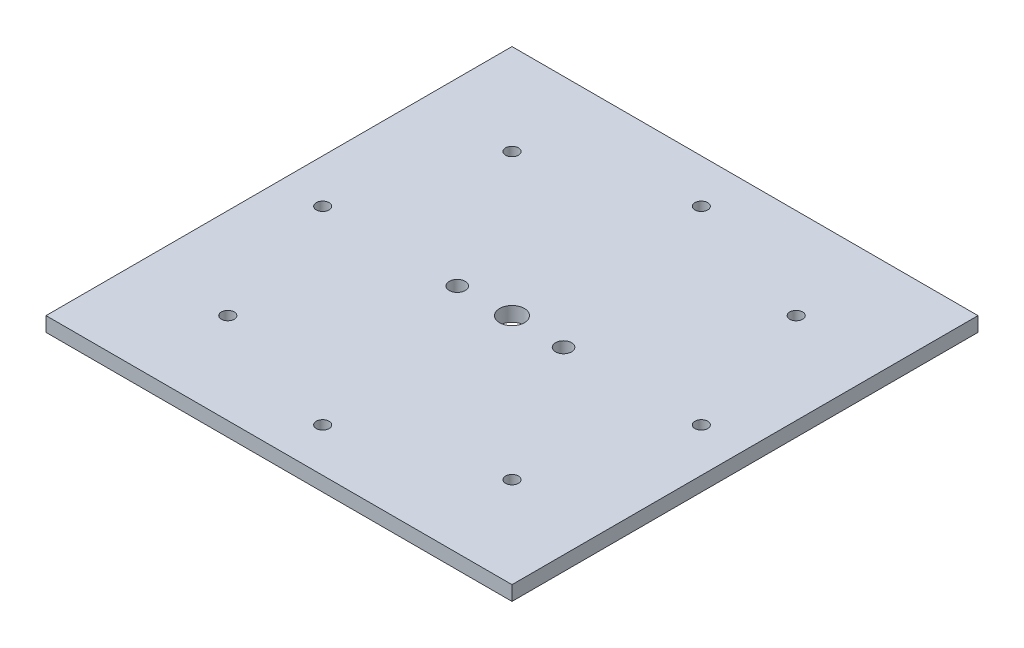
from build123d import *

# Parameters (mm, degrees)
SKETCH1_W           = 160
SKETCH1_H           = 160
SKETCH1_R           = 2.2
SKETCH1_R_2         = 4.25
SKETCH1_R_3         = 2.75
BOSS_EXTRUDE1_DEPTH = 5


with BuildPart() as part:
    # Sketch1 → Boss-Extrude1 (new body)
    with BuildSketch(Plane(origin=(0, 0, 0), x_dir=(1, 0, 0), z_dir=(0, 1, 0))):
        Rectangle(SKETCH1_W, SKETCH1_H)
        with Locations((48.790367902, 48.790367902)):
            Circle(SKETCH1_R, mode=Mode.SUBTRACT)
        with Locations((48.790367902, -48.790367902)):
            Circle(SKETCH1_R, mode=Mode.SUBTRACT)
        with Locations((-48.790367902, -48.790367902)):
            Circle(SKETCH1_R, mode=Mode.SUBTRACT)
        with Locations((-48.790367902, 48.790367902)):
            Circle(SKETCH1_R, mode=Mode.SUBTRACT)
        Circle(SKETCH1_R_2, mode=Mode.SUBTRACT)
        with Locations((18.272421355, -0.571625498)):
            Circle(SKETCH1_R_3, mode=Mode.SUBTRACT)
        with Locations((-18.227578645, -0.571625498)):
            Circle(SKETCH1_R_3, mode=Mode.SUBTRACT)
        with Locations((0, 65)):
            Circle(SKETCH1_R, mode=Mode.SUBTRACT)
        with Locations((65, 0)):
            Circle(SKETCH1_R, mode=Mode.SUBTRACT)
        with Locations((0, -65)):
            Circle(SKETCH1_R, mode=Mode.SUBTRACT)
        with Locations((-65, 0)):
            Circle(SKETCH1_R, mode=Mode.SUBTRACT)
    extrude(amount=BOSS_EXTRUDE1_DEPTH)


solid = part.part
